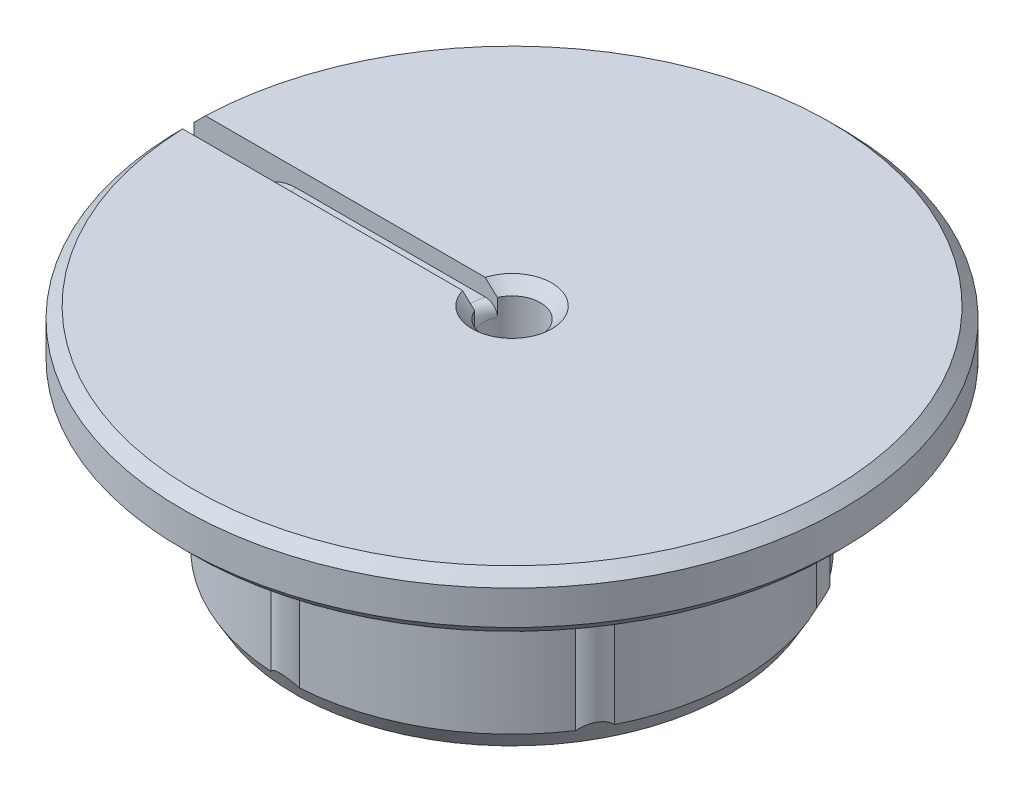
from build123d import *

# Parameters (mm, degrees)
BOSS_EXTRUDE1_START     = -10
BOSS_EXTRUDE1_DEPTH     = 10
CHAMFER1_SIZE           = 1
SKETCH4_W               = 76.07
SKETCH4_H               = 2
CUT_EXTRUDE1_DEPTH      = 46.628938186
CUT_EXTRUDE2_REACH      = 65.581
CUT_EXTRUDE2_END_RADIUS = 2.5
SKETCH5_W               = 2
SKETCH5_H               = 1.5
FILLET1_R               = 4
FILLET2_R               = 1


with BuildPart() as part:
    # Sketch1 → Revolve1 (revolve)
    with BuildSketch(Plane.XY, mode=Mode.PRIVATE) as revolve1_sk:
        Polygon((0, 0), (20, 0), (20, 15), (29, 15), (29, 20), (2.5, 20), (2.5, 10), (0, 10), align=None)
    revolve(revolve1_sk.sketch.rotate(Axis((0, 0, 0), (0, 1, 0)), 90), axis=Axis((0, 0, 0), (0, 1, 0)))

    # Sketch2 → Boss-Extrude1 (add)
    with BuildSketch(Plane.XZ.offset(BOSS_EXTRUDE1_START)):
        with BuildLine():
            ThreePointArc((-1.25, 19.960899278), (0, 20.42), (1.25, 19.960899278))
            ThreePointArc((1.25, 19.960899278), (10, 17.320508076), (16.661645857, 11.062981394))
            ThreePointArc((16.661645857, 11.062981394), (17.684238745, 10.21), (17.911645857, 8.897917884))
            ThreePointArc((17.911645857, 8.897917884), (20, 0), (17.911645857, -8.897917884))
            ThreePointArc((17.911645857, -8.897917884), (17.684238745, -10.21), (16.661645857, -11.062981394))
            ThreePointArc((16.661645857, -11.062981394), (10, -17.320508076), (1.25, -19.960899278))
            ThreePointArc((1.25, -19.960899278), (0, -20.42), (-1.25, -19.960899278))
            ThreePointArc((-1.25, -19.960899278), (-10, -17.320508076), (-16.661645857, -11.062981394))
            ThreePointArc((-16.661645857, -11.062981394), (-17.684238745, -10.21), (-17.911645857, -8.897917884))
            ThreePointArc((-17.911645857, -8.897917884), (-20, 0), (-17.911645857, 8.897917884))
            ThreePointArc((-17.911645857, 8.897917884), (-17.684238745, 10.21), (-16.661645857, 11.062981394))
            ThreePointArc((-16.661645857, 11.062981394), (-10, 17.320508076), (-1.25, 19.960899278))
        make_face()
    extrude(amount=BOSS_EXTRUDE1_DEPTH)

    # Sketch3 → Cut-Revolve1 (revolve, cut)
    with BuildSketch(Plane.XY, mode=Mode.PRIVATE) as cut_revolve1_sk:
        Polygon((-21, 3.232050808), (-18.556624327, -1), (-21, -1), align=None)
    revolve(cut_revolve1_sk.sketch.rotate(Axis((0, 29.336873575, 0), (0, -1, 0)), 273.58332148), axis=Axis((0, 29.336873575, 0), (0, -1, 0)), mode=Mode.SUBTRACT)

    # Chamfer1
    chamfer1_edges = [part.edges().sort_by_distance(p)[0] for p in [
        (0, 20, 2.5),
        (0, 20, 29),
        (0, 15, 29),
    ]]
    chamfer(chamfer1_edges, length=CHAMFER1_SIZE)

    # Sketch4 → Cut-Extrude1 (cut, through all)
    with BuildSketch(Plane.XZ):
        with Locations((-61.965, 0)):
            Rectangle(SKETCH4_W, SKETCH4_H)
    extrude(amount=-CUT_EXTRUDE1_DEPTH, mode=Mode.SUBTRACT)

    # Cut-Extrude2: up to this cylinder (the profile starts outside it)
    cut_extrude2_end = Plane(origin=(0, 19.25, 0), z_dir=(0, -1, 0)) * Cylinder(CUT_EXTRUDE2_END_RADIUS, 137.162, mode=Mode.PRIVATE)
    # Sketch5 → Cut-Extrude2 (cut, up to the surface)
    with BuildSketch(Plane.ZY.offset(23.93), mode=Mode.PRIVATE) as cut_extrude2_sk1:
        with Locations((0, 19.25)):
            Rectangle(SKETCH5_W, SKETCH5_H)
    cut_extrude2_tool1 = extrude(cut_extrude2_sk1.sketch, amount=-CUT_EXTRUDE2_REACH, mode=Mode.PRIVATE) - cut_extrude2_end
    add(cut_extrude2_tool1.solids().sort_by_distance((-23.93, 19.25, 0))[0], mode=Mode.SUBTRACT)

    # Fillet1
    # the kernel refuses this fillet: 4 mm, written as the material it takes off along each edge
    with BuildSketch(Plane(origin=(-23.93, 18.5, 1), x_dir=(1, 0, 0), z_dir=(0, 0, -1))) as fillet1_piece_1:
        with BuildLine():
            CenterArc((3.968626967, 4), FILLET1_R, 187.180755781, 82.819244219)
            Line((0, 3.5), (-0.079372539, 3.49))
            ThreePointArc((-0.079372539, 3.49), (-0.08, 1.75), (-0.08, 0))
            Line((-0.08, 0), (0, -0.08))
            Line((0, -0.08), (3.968626967, -0.08))
            Line((3.968626967, -0.08), (3.968626967, 0))
        make_face()
    extrude(amount=2, mode=Mode.SUBTRACT)

    # Fillet2
    fillet2_edges = [part.edges().sort_by_distance(p)[0] for p in [
        (-2.5, 18.5, 0),
    ]]
    fillet(fillet2_edges, radius=FILLET2_R)


solid = part.part
